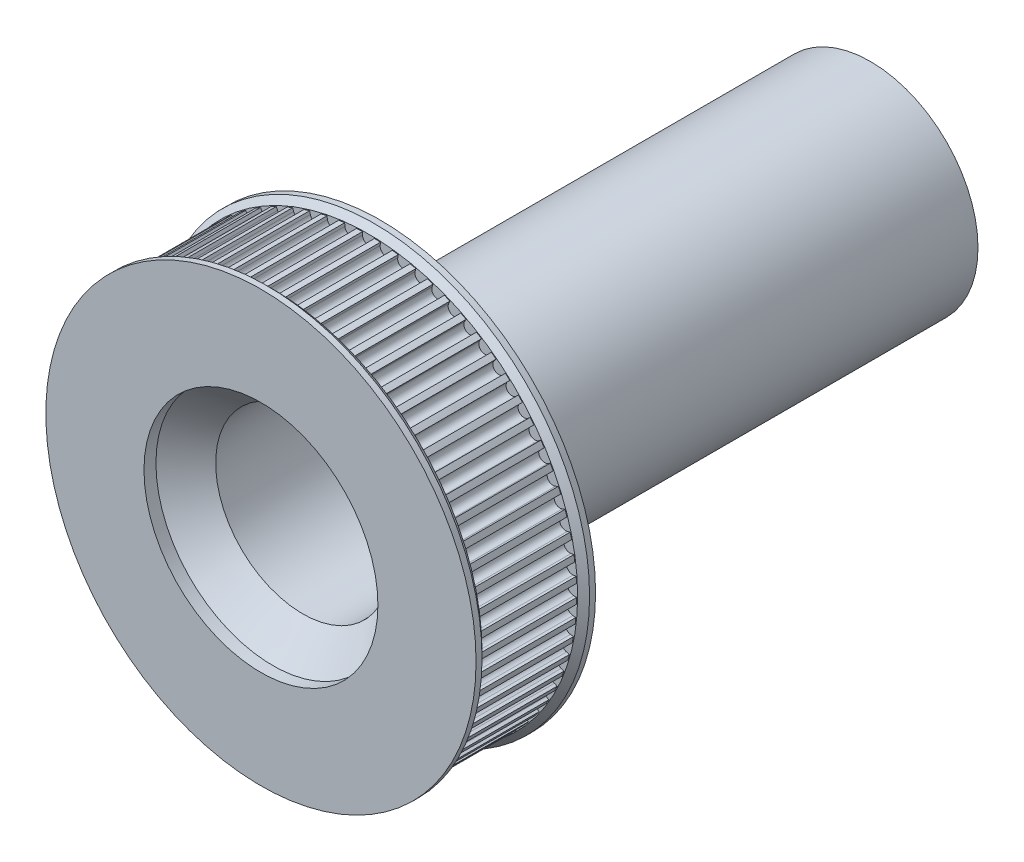
from build123d import *

# Parameters (mm, degrees)
SKETCH1_R           = 18
BOSS_EXTRUDE1_DEPTH = 100
SKETCH2_R           = 14.576002813
CUT_EXTRUDE1_DEPTH  = 85
SKETCH3_R           = 4.5
CUT_EXTRUDE2_DEPTH  = 60
SKETCH4_R           = 34.85
SKETCH4_R_2         = 14.576002813
BOSS_EXTRUDE2_DEPTH = 18
CUT_EXTRUDE3_START  = -13
SKETCH5_R           = 3.181436575
CUT_EXTRUDE3_DEPTH  = 4
CHAMFER2_SIZE       = 5
CHAMFER3_SIZE       = 5
CUT_EXTRUDE4_DEPTH  = 18
CIRPATTERN1_COUNT   = 73
SKETCH7_R           = 36
SKETCH7_R_2         = 19.576002813
BOSS_EXTRUDE3_DEPTH = 2
LPATTERN1_COUNT     = 2
LPATTERN1_PITCH     = 18
CHAMFER4_SIZE       = 1
SKETCH_1_R          = 3.5
CUT_EXTRUDE_1_DEPTH = 4
SKETCH_2_W          = 4
SKETCH_2_H          = 8.481245918
CUT_EXTRUDE_2_DEPTH = 12


with BuildPart() as part:
    # Sketch1 → Boss-Extrude1 (new body)
    with BuildSketch(Plane.XY):
        Circle(SKETCH1_R)
    extrude(amount=BOSS_EXTRUDE1_DEPTH)

    # Sketch2 → Cut-Extrude1 (cut)
    with BuildSketch(Plane.XY.offset(100)):
        Circle(SKETCH2_R)
    extrude(amount=-CUT_EXTRUDE1_DEPTH, mode=Mode.SUBTRACT)

    # Sketch3 → Cut-Extrude2 (cut)
    with BuildSketch(Plane(origin=(0, 0, 0), x_dir=(-1, 0, 0), z_dir=(0, 0, -1))):
        Circle(SKETCH3_R)
    extrude(amount=-CUT_EXTRUDE2_DEPTH, mode=Mode.SUBTRACT)

    # Sketch4 → Boss-Extrude2 (add)
    with BuildSketch(Plane.XY.offset(100)):
        Circle(SKETCH4_R)
        Circle(SKETCH4_R_2, mode=Mode.SUBTRACT)
    extrude(amount=-BOSS_EXTRUDE2_DEPTH)

    # Sketch5 → Cut-Extrude3 (cut)
    with BuildSketch(Plane.XY.offset(100).offset(CUT_EXTRUDE3_START)):
        with Locations((1.618994911, -28.119385301)):
            Circle(SKETCH5_R)
    extrude(amount=-CUT_EXTRUDE3_DEPTH, mode=Mode.SUBTRACT)

    # Chamfer2
    chamfer2_edges = [part.edges().sort_by_distance(p)[0] for p in [
        (-14.576002813, 0, 15),
    ]]
    chamfer(chamfer2_edges, length=CHAMFER2_SIZE)

    # Chamfer3
    chamfer3_edges = [part.edges().sort_by_distance(p)[0] for p in [
        (-14.576002813, 0, 100),
    ]]
    chamfer(chamfer3_edges, length=CHAMFER3_SIZE)

    # Sketch6 → Cut-Extrude4 (cut)
    with BuildSketch(Plane.XY.offset(100)):
        with BuildLine():
            Line((1, 35.669255209), (1, 34.337502479))
            ThreePointArc((1, 34.337502479), (0, 33.337502479), (-1, 34.337502479))
            Line((-1, 34.337502479), (-1, 35.669255209))
            ThreePointArc((-1, 35.669255209), (0, 36.669255209), (1, 35.669255209))
        make_face()
    cut_extrude4 = extrude(amount=-CUT_EXTRUDE4_DEPTH, mode=Mode.SUBTRACT)

    # CirPattern1: Cut-Extrude4 ×73 about axis
    cirpattern1_axis = Axis((0, 0, 100), (0, 0, 1))
    for i in range(1, CIRPATTERN1_COUNT):
        add(cut_extrude4.rotate(cirpattern1_axis, i * 360 / CIRPATTERN1_COUNT), mode=Mode.SUBTRACT)

    # Sketch7 → Boss-Extrude3 (add)
    with BuildSketch(Plane.XY.offset(100)):
        Circle(SKETCH7_R)
        Circle(SKETCH7_R_2, mode=Mode.SUBTRACT)
    boss_extrude3 = extrude(amount=BOSS_EXTRUDE3_DEPTH)

    # LPattern1: Boss-Extrude3 ×2
    with Locations(*[(0, 0, -i * LPATTERN1_PITCH) for i in range(1, LPATTERN1_COUNT)]):
        add(boss_extrude3)

    # Chamfer4
    chamfer4_edges = [part.edges().sort_by_distance(p)[0] for p in [
        (-36, 0, 100),
        (-36, 0, 84),
    ]]
    chamfer(chamfer4_edges, length=CHAMFER4_SIZE)

    # Эскиз1 → Вырез-Вытянуть1 (cut)
    with BuildSketch(Plane(origin=(0, 0, 82), x_dir=(-1, 0, 0), z_dir=(0, 0, -1))):
        with Locations((-9.411948848, 27.775437053)):
            Circle(SKETCH_1_R)
    extrude(amount=-CUT_EXTRUDE_1_DEPTH, mode=Mode.SUBTRACT)

    # Эскиз2 → Вырез-Вытянуть2 (cut)
    with BuildSketch(Plane(origin=(0, 0, 0), x_dir=(-1, 0, 0), z_dir=(0, 0, -1))):
        with Locations((0, 4.285856271)):
            Rectangle(SKETCH_2_W, SKETCH_2_H)
    extrude(amount=-CUT_EXTRUDE_2_DEPTH, mode=Mode.SUBTRACT)


solid = part.part
